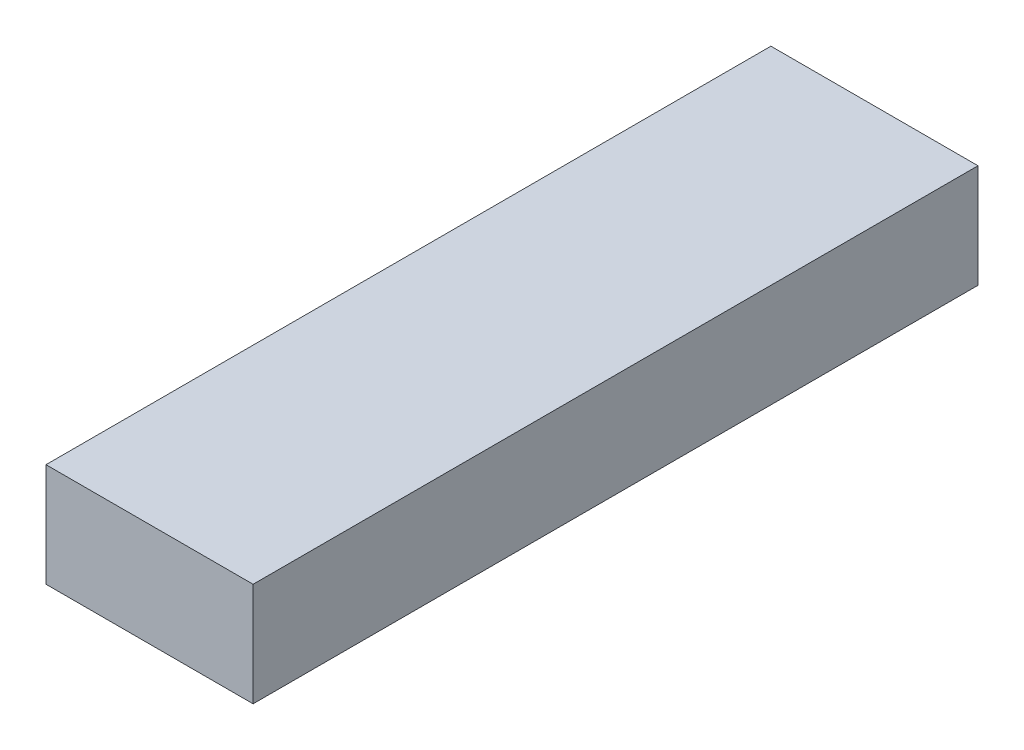
from build123d import *

# Parameters (mm, degrees)
SKETCH1_W           = 6.35
SKETCH1_H           = 22.225
BOSS_EXTRUDE1_DEPTH = 3.175


with BuildPart() as part:
    # Sketch1 → Boss-Extrude1 (new body)
    with BuildSketch(Plane(origin=(0, 0, 0), x_dir=(1, 0, 0), z_dir=(0, 1, 0))):
        with Locations((3.175, 11.1125)):
            Rectangle(SKETCH1_W, SKETCH1_H)
    extrude(amount=BOSS_EXTRUDE1_DEPTH)


solid = part.part
